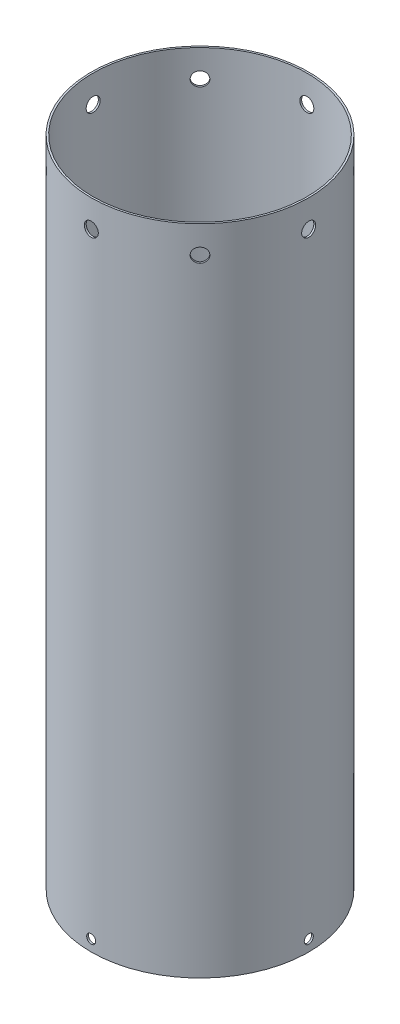
from build123d import *

# Parameters (mm, degrees)
SKETCH1_R           = 76.2
BOSS_EXTRUDE1_DEPTH = 457.2
SKETCH2_R           = 74.93
CUT_EXTRUDE1_DEPTH  = 470.728347026
SKETCH3_R           = 4.8895
CUT_EXTRUDE2_DEPTH  = 470.728347026
CIRPATTERN1_COUNT   = 8
SKETCH4_R           = 3.175
CUT_EXTRUDE3_DEPTH  = 470.728347156
CIRPATTERN2_COUNT   = 4


with BuildPart() as part:
    # Sketch1 → Boss-Extrude1 (new body)
    with BuildSketch(Plane(origin=(0, 0, 0), x_dir=(1, 0, 0), z_dir=(0, 1, 0))):
        Circle(SKETCH1_R)
    extrude(amount=BOSS_EXTRUDE1_DEPTH)

    # Sketch2 → Cut-Extrude1 (cut, through all)
    with BuildSketch(Plane(origin=(0, 457.2, 0), x_dir=(1, 0, 0), z_dir=(0, 1, 0))):
        Circle(SKETCH2_R)
    extrude(amount=-CUT_EXTRUDE1_DEPTH, mode=Mode.SUBTRACT)

    # Sketch3 → Cut-Extrude2 (cut, symmetric)
    with BuildSketch(Plane.XY):
        with Locations((0, 438.15)):
            Circle(SKETCH3_R)
    cut_extrude2 = extrude(amount=CUT_EXTRUDE2_DEPTH, both=True, mode=Mode.SUBTRACT)

    # CirPattern1: Cut-Extrude2 ×8 about axis
    cirpattern1_axis = Axis((0, 457.2, 0), (0, -1, 0))
    for i in range(1, CIRPATTERN1_COUNT):
        add(cut_extrude2.rotate(cirpattern1_axis, i * 360 / CIRPATTERN1_COUNT), mode=Mode.SUBTRACT)

    # Sketch4 → Cut-Extrude3 (cut, symmetric)
    with BuildSketch(Plane.XY):
        with Locations((0, 7.9375)):
            Circle(SKETCH4_R)
    cut_extrude3 = extrude(amount=CUT_EXTRUDE3_DEPTH, both=True, mode=Mode.SUBTRACT)

    # CirPattern2: Cut-Extrude3 ×4 about axis
    cirpattern2_axis = Axis((0, 457.2, 0), (0, -1, 0))
    for i in range(1, CIRPATTERN2_COUNT):
        add(cut_extrude3.rotate(cirpattern2_axis, i * 360 / CIRPATTERN2_COUNT), mode=Mode.SUBTRACT)


solid = part.part
